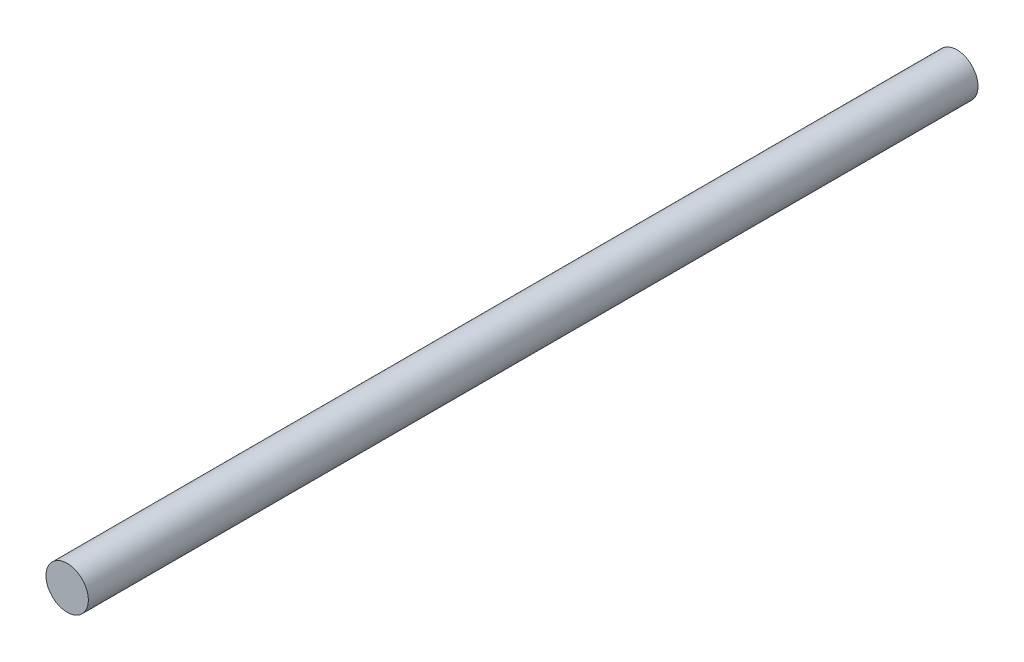
from build123d import *

# Parameters (mm, degrees)
SKETCH_1_R        = 2
EXTRUDE_303_DEPTH = 84


with BuildPart() as part:
    # Эскиз1 → Extrude 303 (new body)
    with BuildSketch(Plane.XY):
        Circle(SKETCH_1_R)
    extrude(amount=EXTRUDE_303_DEPTH)


solid = part.part
